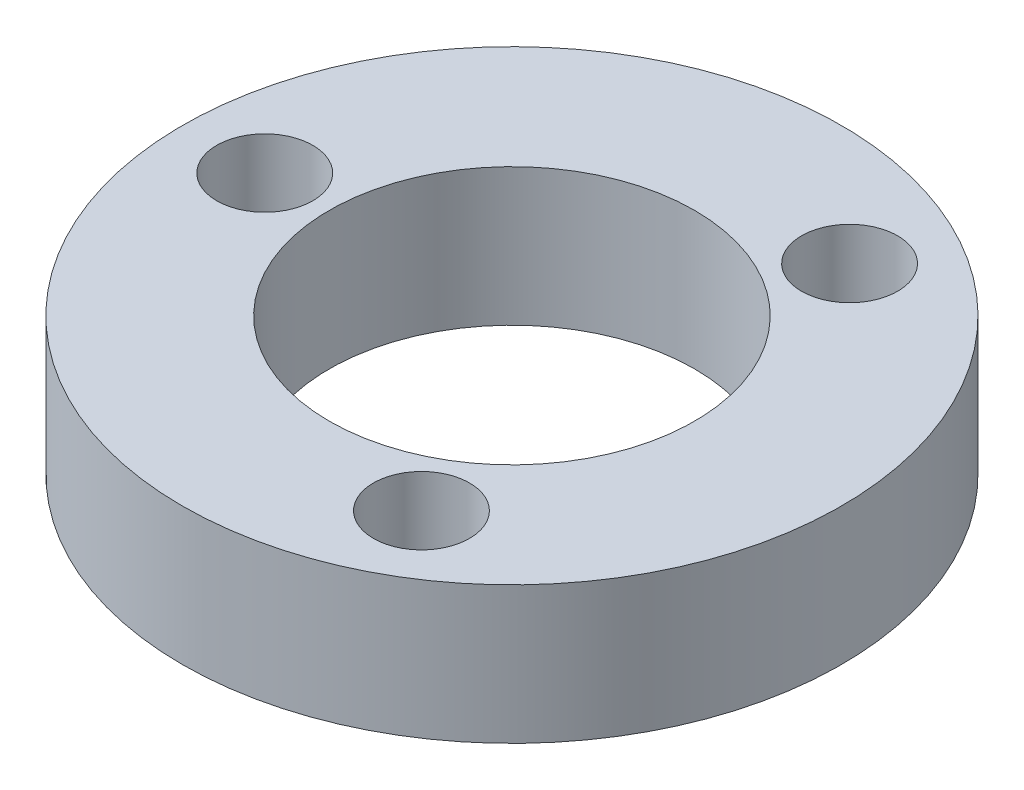
from build123d import *

# Parameters (mm, degrees)
SKETCH_1_R      = 12
SKETCH_1_R_2    = 6.65
SKETCH_1_R_3    = 1.75
EXTRUDE_1_DEPTH = 5


with BuildPart() as part:
    # Эскиз1 → Бобышка-Вытянуть1 (new body)
    with BuildSketch(Plane(origin=(0, 0, 0), x_dir=(1, 0, 0), z_dir=(0, 1, 0))):
        Circle(SKETCH_1_R)
        Circle(SKETCH_1_R_2, mode=Mode.SUBTRACT)
        with Locations((-9, 0)):
            Circle(SKETCH_1_R_3, mode=Mode.SUBTRACT)
        with Locations((4.5, 7.794228634)):
            Circle(SKETCH_1_R_3, mode=Mode.SUBTRACT)
        with Locations((4.5, -7.794228634)):
            Circle(SKETCH_1_R_3, mode=Mode.SUBTRACT)
    extrude(amount=EXTRUDE_1_DEPTH)


solid = part.part
